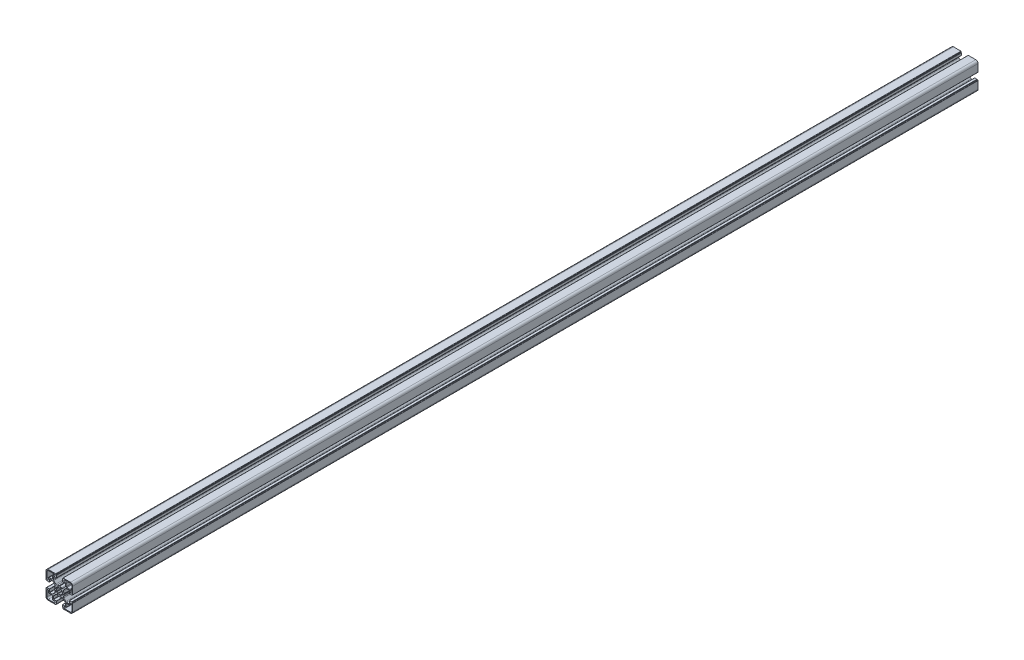
from build123d import *

# Parameters (mm, degrees)
BOSS_EXTRUDE1_DEPTH      = 762
FILLET4_R                = 1.95
FILLET5_R                = 0.39
DELETEFACE1_START        = -762
DELETEFACE1_DEPTH        = 1524
CUT_EXTRUDE1_DEPTH       = 763.664080707
CIRPATTERN2_COUNT        = 3
CIRPATTERN2_ANGLE        = 180
FILLET2_R                = 0.39
FILLET3_R                = 0.195
CUT_EXTRUDE2_DEPTH       = 1525.332148844
CUT_EXTRUDE2_DEPTH_BACK  = 1525.332148844
SKETCH5_R                = 6.375
BOSS_EXTRUDE2_DEPTH      = 762
FILLET6_R                = 0.39
CIRPATTERN1_COUNT        = 8
FILLET6_OF_CIRPATTERN1_R = 0.39
CUT_EXTRUDE3_DEPTH       = 763.664080707
CUT_EXTRUDE3_DEPTH_BACK  = 763.664080707


# Read off the part's stored shape, not the designer's step: DeleteFace1
with BuildPart() as part:
    # Sketch3 → Boss-Extrude1 (new, symmetric)
    with BuildSketch(Plane.XY):
        with BuildLine():
            Line((0, -8), (0, -5))
            ThreePointArc((0, -5), (3.535533906, -3.535533906), (5, 0))
            Line((5, 0), (8, 0))
            ThreePointArc((8, 0), (7.578104083, -2.563657252), (6.356915373, -4.856915373))
            Line((6.356915373, -4.856915373), (11.55, -10.05))
            Line((11.55, -10.05), (16.7, -10.05))
            Line((16.7, -10.05), (16.7, -5))
            Line((16.7, -5), (21, -5))
            Line((21, -5), (21, 0))
            Line((21, 0), (22.5, 0))
            Line((22.5, 0), (22.5, -18.75))
            ThreePointArc((22.5, -18.75), (21.401650429, -21.401650429), (18.75, -22.5))
            Line((18.75, -22.5), (0, -22.5))
            Line((0, -22.5), (0, -21))
            Line((0, -21), (5, -21))
            Line((5, -21), (5, -16.7))
            Line((5, -16.7), (10.05, -16.7))
            Line((10.05, -16.7), (10.05, -11.55))
            Line((10.05, -11.55), (4.856915373, -6.356915373))
            ThreePointArc((4.856915373, -6.356915373), (2.563657252, -7.578104083), (0, -8))
        make_face()
        with BuildLine():
            Line((18.2, -8.79375), (18.2, -10.575))
            ThreePointArc((18.2, -10.575), (17.914429112, -11.264429112), (17.225, -11.55))
            Line((17.225, -11.55), (12.525, -11.55))
            ThreePointArc((12.525, -11.55), (11.835570888, -11.835570888), (11.55, -12.525))
            Line((11.55, -12.525), (11.55, -17.225))
            ThreePointArc((11.55, -17.225), (11.264429112, -17.914429112), (10.575, -18.2))
            Line((10.575, -18.2), (8.79375, -18.2))
            ThreePointArc((8.79375, -18.2), (7.39375, -19.6), (8.79375, -21))
            Line((8.79375, -21), (18.75, -21))
            ThreePointArc((18.75, -21), (20.340990258, -20.340990258), (21, -18.75))
            Line((21, -18.75), (21, -8.79375))
            ThreePointArc((21, -8.79375), (19.6, -7.39375), (18.2, -8.79375))
        make_face(mode=Mode.SUBTRACT)
    extrude(amount=BOSS_EXTRUDE1_DEPTH, both=True)

    # Fillet4
    fillet4_edges = [part.edges().sort_by_distance(p)[0] for p in [
        (10.05, -11.55, 0),
        (4.856915373, -6.356915373, 0),
        (6.356915373, -4.856915373, 0),
        (11.55, -10.05, 0),
    ]]
    fillet(fillet4_edges, radius=FILLET4_R)

    # Fillet5
    fillet5_edges = [part.edges().sort_by_distance(p)[0] for p in [
        (5, -21, 0),
        (5, -16.7, 0),
        (10.05, -16.7, 0),
        (16.7, -10.05, 0),
        (16.7, -5, 0),
        (21, -5, 0),
    ]]
    fillet(fillet5_edges, radius=FILLET5_R)

    # Mirror1: part across plane


with BuildPart() as part_1:
    add(part.part)
    add(part.part.mirror(Plane.ZX))

    # DeleteFace1 outline → DeleteFace1 (cut)
    with BuildSketch(Plane.XY.offset(DELETEFACE1_START)):
        with BuildLine():
            ThreePointArc((4.61, 21), (4.885771645, 20.885771645), (5, 20.61))
            Line((5, 20.61), (5, 21))
            Line((5, 21), (4.61, 21))
        make_face()
    extrude(amount=DELETEFACE1_DEPTH, mode=Mode.SUBTRACT)

    # Sketch4 → Cut-Extrude1 (cut, symmetric)
    with BuildSketch(Plane.XY):
        Polygon((5.8, 21), (5.8, 22.5), (0, 22.5), (-5.8, 22.5), (-5.8, 21), (-5, 21), (-5, 16.7), (5, 16.7), (5, 21), align=None)
    cut_extrude1 = extrude(amount=CUT_EXTRUDE1_DEPTH, both=True, mode=Mode.SUBTRACT)

    # CirPattern2: Cut-Extrude1 ×3 about axis
    cirpattern2_axis = Axis((0, 0, 717), (0, 0, -1))
    for i in range(1, CIRPATTERN2_COUNT):
        add(cut_extrude1.rotate(cirpattern2_axis, i * CIRPATTERN2_ANGLE / (CIRPATTERN2_COUNT - 1)), mode=Mode.SUBTRACT)

    # Fillet2
    fillet2_edges = [part_1.edges().sort_by_distance(p)[0] for p in [
        (5.8, 22.5, 0),
        (22.5, 5.8, 0),
        (22.5, -5.8, 0),
        (5.8, -22.5, 0),
    ]]
    fillet(fillet2_edges, radius=FILLET2_R)

    # Fillet3
    fillet3_edges = [part_1.edges().sort_by_distance(p)[0] for p in [
        (5, 21, 0),
        (5.8, 21, 0),
        (21, -5, 0),
        (21, -5.8, 0),
        (21, 5, 0),
        (21, 5.8, 0),
        (5, -21, 0),
        (5.8, -21, 0),
    ]]
    fillet(fillet3_edges, radius=FILLET3_R)

    # Mirror2: part across plane


with BuildPart() as part_2:
    add(part_1.part)
    add(part_1.part.mirror(Plane(origin=(0, 0, 0), x_dir=(0, 0, 1), z_dir=(1, 0, 0))))

    # Sketch5 → Cut-Extrude2 (cut, two sides: drawn at the far end of the back side and taken through both)
    with BuildSketch(Plane.XY.offset(762).offset(-CUT_EXTRUDE2_DEPTH_BACK)):
        Circle(SKETCH5_R)
        Polygon((-0.580185128, 8), (0.580185128, 8), (0, 7.59375), align=None)
        Polygon((-8, 0.580185128), (-8, -0.580185128), (-7.59375, 0), align=None)
        Polygon((8, 0.580185128), (8, -0.580185128), (7.59375, 0), align=None)
        Polygon((-0.580185128, -8), (0.580185128, -8), (0, -7.59375), align=None)
    extrude(amount=CUT_EXTRUDE2_DEPTH + CUT_EXTRUDE2_DEPTH_BACK, mode=Mode.SUBTRACT)

    # Sketch6 → Boss-Extrude2 (add, symmetric)
    with BuildSketch(Plane.XY):
        with BuildLine():
            Line((-0.97545161, -4.903926402), (-1.243700803, -6.252506163))
            ThreePointArc((-1.243700803, -6.252506163), (0, -6.375), (1.243700803, -6.252506163))
            Line((1.243700803, -6.252506163), (0.97545161, -4.903926402))
            ThreePointArc((0.97545161, -4.903926402), (0, -5), (-0.97545161, -4.903926402))
        make_face()
    boss_extrude2 = extrude(amount=BOSS_EXTRUDE2_DEPTH, both=True)

    # Fillet6
    fillet6_edges = [part_2.edges().sort_by_distance(p)[0] for p in [
        (-1.243700803, -6.252506163, 0),
        (1.243700803, -6.252506163, 0),
    ]]
    fillet(fillet6_edges, radius=FILLET6_R)

    # CirPattern1: Boss-Extrude2 ×8 about axis
    cirpattern1_axis = Axis((0, 0, 0), (0, 0, 1))
    for i in range(1, CIRPATTERN1_COUNT):
        add(boss_extrude2.rotate(cirpattern1_axis, i * 360 / CIRPATTERN1_COUNT))

    # Fillet6 of CirPattern1
    fillet6_of_cirpattern1_edges = [part_2.edges().sort_by_distance(p)[0] for p in [
        (3.541760235, -5.300618778, 0),
        (5.300618778, -3.541760235, 0),
        (6.252506163, -1.243700803, 0),
        (6.252506163, 1.243700803, 0),
        (5.300618778, 3.541760235, 0),
        (3.541760235, 5.300618778, 0),
        (1.243700803, 6.252506163, 0),
        (-1.243700803, 6.252506163, 0),
        (-3.541760235, 5.300618778, 0),
        (-5.300618778, 3.541760235, 0),
        (-6.252506163, 1.243700803, 0),
        (-6.252506163, -1.243700803, 0),
        (-5.300618778, -3.541760235, 0),
        (-3.541760235, -5.300618778, 0),
    ]]
    fillet(fillet6_of_cirpattern1_edges, radius=FILLET6_OF_CIRPATTERN1_R)

    # Sketch7 → Cut-Extrude3 (cut, two sides: drawn at the far end of the back side and taken through both)
    with BuildSketch(Plane.XY.offset(-CUT_EXTRUDE3_DEPTH_BACK)):
        Polygon((-7.046875, 16.7), (-6.596875, 17.15), (-6.146875, 16.7), align=None)
    extrude(amount=CUT_EXTRUDE3_DEPTH + CUT_EXTRUDE3_DEPTH_BACK, mode=Mode.SUBTRACT)


solid = part_2.part
